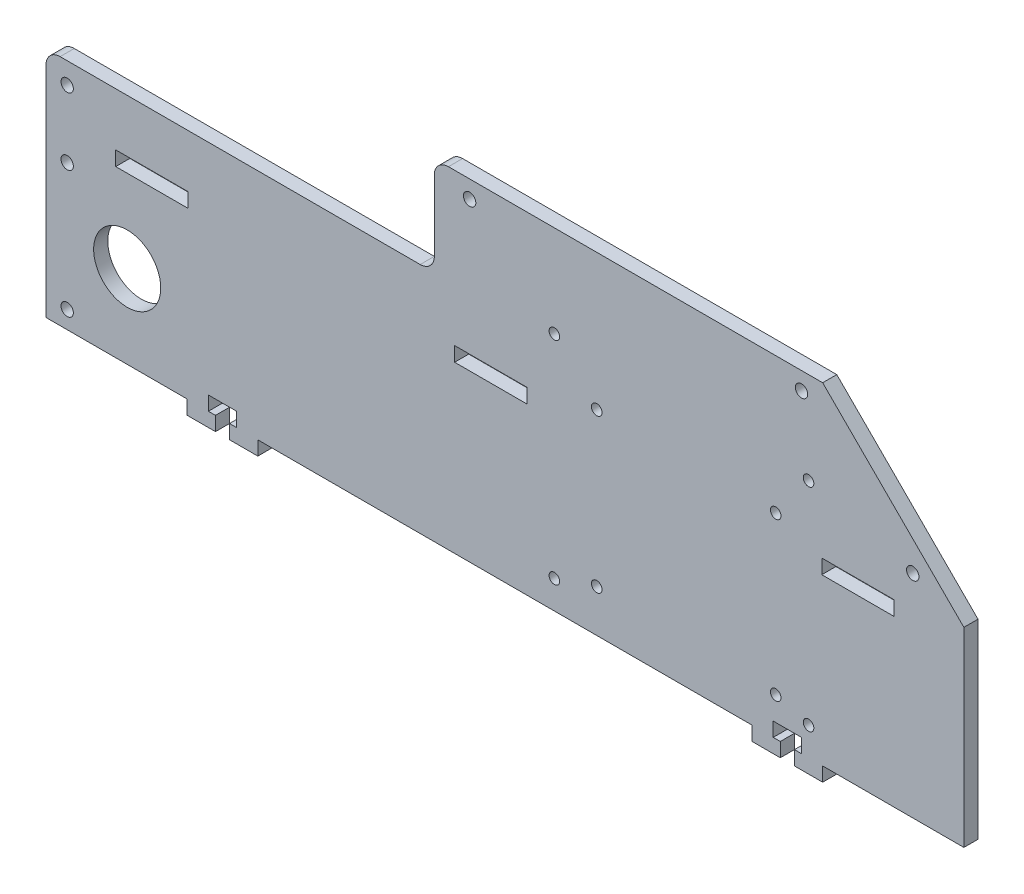
from build123d import *

# Parameters (mm, degrees)
SKETCH_1_R             = 9.5
SKETCH_1_R_2           = 1.5
SKETCH_1_W             = 20.5
SKETCH_1_H             = 4.1
SM_BASE_FLANGE_1_DEPTH = 4
SKETCH_6_R             = 1.75
CUT_EXTRUDE_1_DEPTH    = 267.640207021
SKETCH_8_R             = 1
SKETCH_8_R_2           = 0.822154456
CUT_EXTRUDE_3_DEPTH    = 10


# Sheet-metal steps are written as plain solids
with BuildPart() as part:
    # Sketch 1 → Базовая кромка1 (new body)
    with BuildSketch(Plane.XY):
        with BuildLine():
            Line((52, -59), (60, -59))
            Line((60, -59), (60, -55))
            Line((60, -55), (200, -55))
            Line((200, -55), (200, -59))
            Line((200, -59), (208, -59))
            Line((208, -59), (208, -55))
            Line((208, -55), (206, -55))
            Line((206, -55), (206, -51))
            Line((206, -51), (214, -51))
            Line((214, -51), (214, -55))
            Line((214, -55), (212, -55))
            Line((212, -55), (212, -59))
            Line((212, -59), (220, -59))
            Line((220, -59), (220, -55))
            Line((220, -55), (260, -55))
            Line((260, -55), (260, -1))
            Line((260, -1), (220, 39))
            Line((220, 39), (120, 39))
            Line((120, 39), (114, 39))
            ThreePointArc((114, 39), (111.171572875, 37.828427125), (110, 35))
            Line((110, 35), (110, 15))
            ThreePointArc((110, 15), (108.828427125, 12.171572875), (106, 11))
            Line((106, 11), (4, 11))
            ThreePointArc((4, 11), (1.171572875, 9.828427125), (0, 7))
            Line((0, 7), (0, 0))
            Line((0, 0), (0, -55))
            Line((0, -55), (40, -55))
            Line((40, -55), (40, -59))
            Line((40, -59), (48, -59))
            Line((48, -59), (48, -55))
            Line((48, -55), (46, -55))
            Line((46, -55), (46, -51))
            Line((46, -51), (54, -51))
            Line((54, -51), (54, -55))
            Line((54, -55), (52, -55))
            Line((52, -55), (52, -59))
        make_face()
        with Locations((23, -31.5)):
            Circle(SKETCH_1_R, mode=Mode.SUBTRACT)
        with Locations((156, -43)):
            Circle(SKETCH_1_R_2, mode=Mode.SUBTRACT)
        with Locations((206.7, 0.4)):
            Circle(SKETCH_1_R_2, mode=Mode.SUBTRACT)
        with Locations((156, 0.4)):
            Circle(SKETCH_1_R_2, mode=Mode.SUBTRACT)
        with Locations((206.7, -44.2)):
            Circle(SKETCH_1_R_2, mode=Mode.SUBTRACT)
        with Locations((144, -47)):
            Circle(SKETCH_1_R_2, mode=Mode.SUBTRACT)
        with Locations((216, -47)):
            Circle(SKETCH_1_R_2, mode=Mode.SUBTRACT)
        with Locations((216, 13)):
            Circle(SKETCH_1_R_2, mode=Mode.SUBTRACT)
        with Locations((144, 13)):
            Circle(SKETCH_1_R_2, mode=Mode.SUBTRACT)
        with Locations((30, -6.05)):
            Rectangle(SKETCH_1_W, SKETCH_1_H, mode=Mode.SUBTRACT)
        with Locations((230, -6.169027082)):
            Rectangle(SKETCH_1_W, SKETCH_1_H, mode=Mode.SUBTRACT)
        with Locations((126, -6.05)):
            Rectangle(SKETCH_1_W, SKETCH_1_H, mode=Mode.SUBTRACT)
    extrude(amount=-SM_BASE_FLANGE_1_DEPTH)

    # Эскиз6 → Вырез-Вытянуть1 (cut, through all)
    with BuildSketch(Plane.XY):
        with Locations((6, 5)):
            Circle(SKETCH_6_R)
        with Locations((120, 34)):
            Circle(SKETCH_6_R)
        with Locations((214, 34)):
            Circle(SKETCH_6_R)
        with Locations((245.514718626, 5)):
            Circle(SKETCH_6_R)
        with Locations((6, -14)):
            Circle(SKETCH_6_R)
        with Locations((6, -50)):
            Circle(SKETCH_6_R)
    extrude(amount=-CUT_EXTRUDE_1_DEPTH, mode=Mode.SUBTRACT)

    # Эскиз8 → Вырез-Вытянуть3 (cut)
    with BuildSketch(Plane.XZ.offset(55)):
        with Locations((210, -2)):
            Circle(SKETCH_8_R)
        with Locations((50, -2)):
            Circle(SKETCH_8_R_2)
    extrude(amount=-CUT_EXTRUDE_3_DEPTH, mode=Mode.SUBTRACT)


solid = part.part
